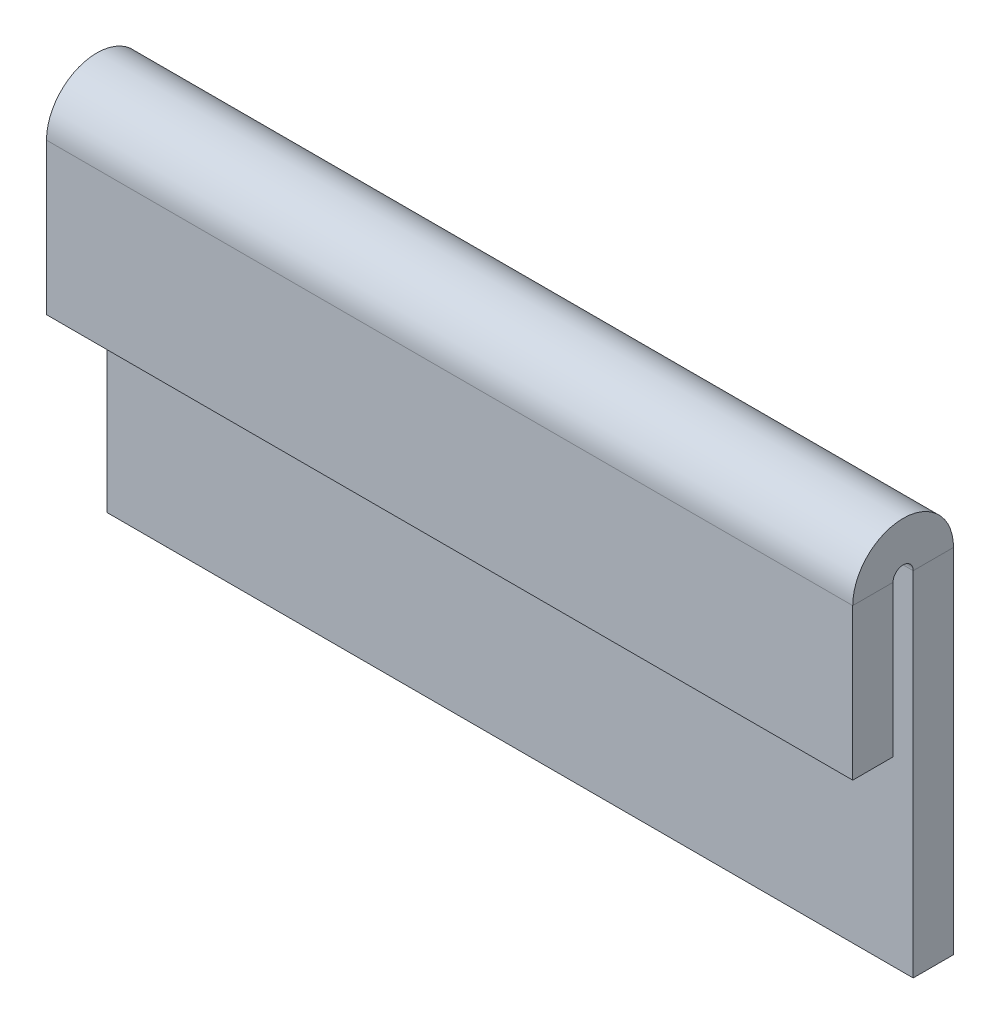
from build123d import *

# Parameters (mm, degrees)
SKETCH_1_W       = 20
SKETCH_1_H       = 10
BASEPLATE_DEPTH  = 1
HEM_OPEN_DEPTH   = 20
HEM_OPEN_2_DEPTH = 20


# Read off the part's stored shape, not the designer's step: Hem_open
# Sheet-metal steps are written as plain solids
with BuildPart() as part:
    # Sketch 1 → BasePlate (new body)
    with BuildSketch(Plane.XY):
        with Locations((10, 5)):
            Rectangle(SKETCH_1_W, SKETCH_1_H)
    extrude(amount=-BASEPLATE_DEPTH)

    # Hem_open outline → Hem_open (cut)
    with BuildSketch(Plane.YZ):
        with BuildLine():
            Line((10, 0), (9.974744871, 0))
            ThreePointArc((9.974744871, 0), (9.540569415, -0.718245837), (8.75, -1))
            Line((8.75, -1), (10, -1))
            Line((10, -1), (10, 0))
        make_face()
    extrude(amount=HEM_OPEN_DEPTH, mode=Mode.SUBTRACT)

    # Hem_open 2 outline → Hem_open 2 (add)
    with BuildSketch(Plane.YZ):
        with BuildLine():
            Line((5, 1.5), (5, 0.5))
            Line((5, 0.5), (8.75, 0.5))
            ThreePointArc((8.75, 0.5), (9, 0.25), (8.75, 0))
            Line((8.75, 0), (9.974744871, 0))
            ThreePointArc((9.974744871, 0), (9.718245837, 1.040569415), (8.75, 1.5))
            Line((8.75, 1.5), (5, 1.5))
        make_face()
    extrude(amount=HEM_OPEN_2_DEPTH)


solid = part.part
